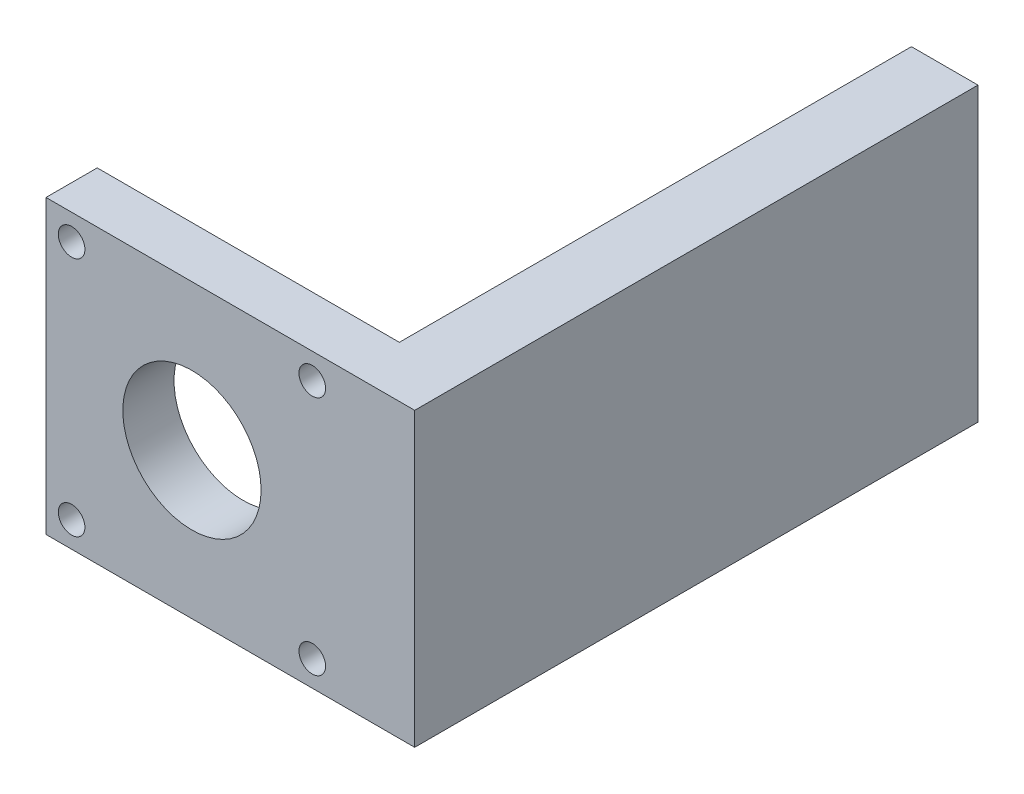
from build123d import *

# Parameters (mm, degrees)
SKETCH1_R           = 2.6
BOSS_EXTRUDE1_DEPTH = 10
SKETCH3_R           = 13.5
CUT_EXTRUDE1_DEPTH  = 105.566836418
SKETCH4_W           = 15
SKETCH4_H           = 57
BOSS_EXTRUDE2_DEPTH = 10
SKETCH5_W           = 13
SKETCH5_H           = 57
BOSS_EXTRUDE3_DEPTH = 100


with BuildPart() as part:
    # Sketch1 → Boss-Extrude1 (new body)
    with BuildSketch(Plane.XY):
        Polygon((-81.297129584, 62), (-81.297129584, 25.5), (-81.297129584, 8), (-78.297129584, 8), (-41.797129584, 8), (-24.297129584, 8), (-24.297129584, 11), (-24.297129584, 47.5), (-24.297129584, 65), (-27.297129584, 65), (-63.797129584, 65), (-81.297129584, 65), align=None)
        with Locations((-76.297129584, 13)):
            Circle(SKETCH1_R, mode=Mode.SUBTRACT)
        with Locations((-29.297129584, 13)):
            Circle(SKETCH1_R, mode=Mode.SUBTRACT)
        with Locations((-29.297129584, 60)):
            Circle(SKETCH1_R, mode=Mode.SUBTRACT)
        with Locations((-76.297129584, 60)):
            Circle(SKETCH1_R, mode=Mode.SUBTRACT)
    extrude(amount=BOSS_EXTRUDE1_DEPTH)

    # Sketch3 → Cut-Extrude1 (cut, through all)
    with BuildSketch(Plane.XY.offset(10)):
        with Locations((-52.797129584, 36.5)):
            Circle(SKETCH3_R)
    extrude(amount=-CUT_EXTRUDE1_DEPTH, mode=Mode.SUBTRACT)

    # Sketch4 → Boss-Extrude2 (add)
    with BuildSketch(Plane.XY.offset(10)):
        with Locations((-16.797129584, 36.5)):
            Rectangle(SKETCH4_W, SKETCH4_H)
    extrude(amount=-BOSS_EXTRUDE2_DEPTH)

    # Sketch5 → Boss-Extrude3 (add)
    with BuildSketch(Plane(origin=(0, 0, 0), x_dir=(-1, 0, 0), z_dir=(0, 0, -1))):
        with Locations((15.797129584, 36.5)):
            Rectangle(SKETCH5_W, SKETCH5_H)
    extrude(amount=BOSS_EXTRUDE3_DEPTH)


solid = part.part
